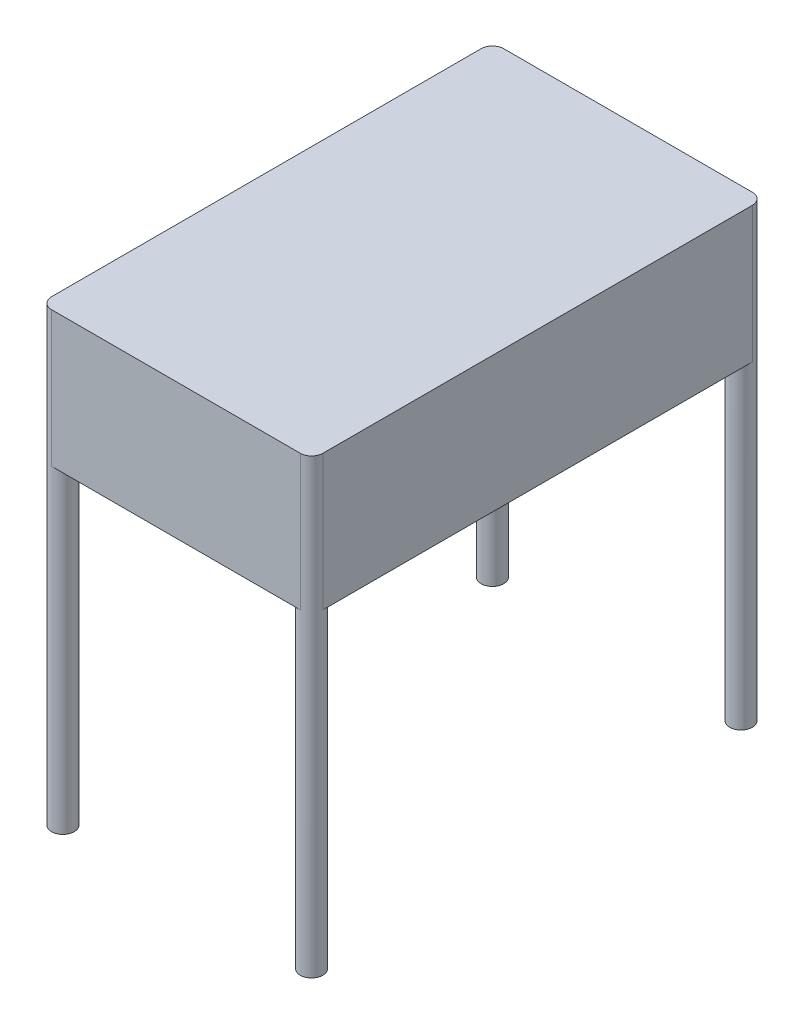
from build123d import *
from build123d.topology import SkipClean

# Parameters (mm, degrees)
SKETCH_2_W               = 600
SKETCH_2_H               = 1000
EXTRUDE_1_DEPTH          = 300
FILLET_1_R               = 25
EXTRUDE_START            = -1000
SKETCH_3_R               = 25
EXTRUDE_2_DEPTH          = 1000
MIRROR_START             = -1000
MIRROR_2_COPY_1_SKETCH_R = 25
MIRROR_2_COPY_1_DEPTH    = 1000


with BuildPart() as part:
    # 草图2 → 凸台-拉伸1 (new body)
    with BuildSketch(Plane(origin=(0, 0, 0), x_dir=(1, 0, 0), z_dir=(0, 1, 0))):
        Rectangle(SKETCH_2_W, SKETCH_2_H)
    extrude(amount=-EXTRUDE_1_DEPTH)

    # 圆角1
    fillet_1_edges = [part.edges().sort_by_distance(p)[0] for p in [
        (-300, -150, -500),
        (300, -150, -500),
        (-300, -150, 500),
        (300, -150, 500),
    ]]
    fillet(fillet_1_edges, radius=FILLET_1_R)

    # 草图3 → 凸台-拉伸2 (add)
    with SkipClean():  # the faces are left unmerged after this step: merging them gives an invalid solid
        with BuildSketch(Plane(origin=(0, 0, 0), x_dir=(1, 0, 0), z_dir=(0, 1, 0)).offset(EXTRUDE_START)):
            with Locations((275, -475)):
                Circle(SKETCH_3_R)
        extrude_2 = extrude(amount=EXTRUDE_2_DEPTH)

    # 镜向1: 凸台-拉伸2 across plane
    with SkipClean():  # the faces are left unmerged after this step: merging them gives an invalid solid
        add(extrude_2.mirror(Plane(origin=(0, 0, 0), x_dir=(0, 0, 1), z_dir=(1, 0, 0))))

    # 镜向2: 凸台-拉伸2 across plane
    with SkipClean():  # the faces are left unmerged after this step: merging them gives an invalid solid
        add(extrude_2.mirror(Plane.XY))

    # 镜向2 copy 1 sketch → 镜向2 copy 1 (add)
    with SkipClean():  # the faces are left unmerged after this step: merging them gives an invalid solid
        with BuildSketch(Plane(origin=(0, 0, 0), x_dir=(-1, 0, 0), z_dir=(0, 1, 0)).offset(MIRROR_START)):
            with Locations((275, -475)):
                Circle(MIRROR_2_COPY_1_SKETCH_R)
        extrude(amount=MIRROR_2_COPY_1_DEPTH)


solid = part.part
